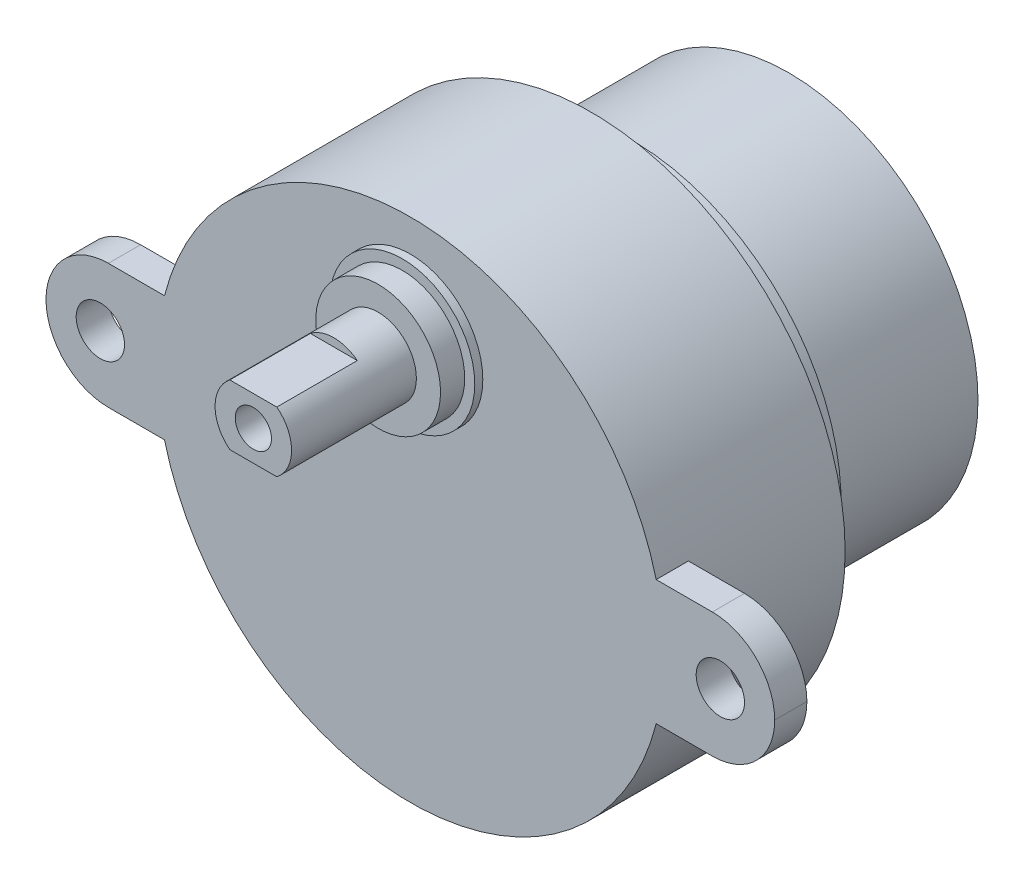
from build123d import *

# Parameters (mm, degrees)
SKETCH1_R               = 16.002
BOSS_EXTRUDE1_DEPTH     = 13.97
SKETCH2_R               = 11.938
BOSS_EXTRUDE2_DEPTH     = 9.906
CUT_EXTRUDE1_START      = -2.54
SKETCH3_R               = 16.002
SKETCH3_R_2             = 13.208
CUT_EXTRUDE1_DEPTH      = 2.54
SKETCH4_W               = 45.974
SKETCH4_H               = 7.874
BOSS_EXTRUDE3_DEPTH     = 2.032
CUT_EXTRUDE2_DEPTH      = 37.803933879
CUT_EXTRUDE2_DEPTH_BACK = 37.803933879
SKETCH5_R               = 1.524
FILLET1_R               = 3.937
SKETCH6_R               = 4.572
BOSS_EXTRUDE4_DEPTH     = 0.508
SKETCH7_R               = 3.937
BOSS_EXTRUDE5_DEPTH     = 2.032
SKETCH8_R               = 2.413
BOSS_EXTRUDE6_DEPTH     = 9.906
CUT_EXTRUDE3_DEPTH      = 44.88268106
CUT_EXTRUDE3_DEPTH_BACK = 5.08
SKETCH10_R              = 1.143
CUT_EXTRUDE4_DEPTH      = 7.874


with BuildPart() as part:
    # Sketch1 → Boss-Extrude1 (new body)
    with BuildSketch(Plane.XY):
        Circle(SKETCH1_R)
    extrude(amount=-BOSS_EXTRUDE1_DEPTH)

    # Sketch2 → Boss-Extrude2 (add)
    with BuildSketch(Plane(origin=(0, 0, -13.97), x_dir=(-1, 0, 0), z_dir=(0, 0, -1))):
        Circle(SKETCH2_R)
    extrude(amount=BOSS_EXTRUDE2_DEPTH)

    # Sketch3 → Cut-Extrude1 (cut)
    with BuildSketch(Plane(origin=(0, 0, -13.97), x_dir=(-1, 0, 0), z_dir=(0, 0, -1)).offset(CUT_EXTRUDE1_START)):
        with Locations(Location((0, 0, 0), (0, 0, 180))):
            Circle(SKETCH3_R)
        Circle(SKETCH3_R_2, mode=Mode.SUBTRACT)
    extrude(amount=CUT_EXTRUDE1_DEPTH, mode=Mode.SUBTRACT)

    # Sketch4 → Boss-Extrude3 (add)
    with BuildSketch(Plane.XY):
        Rectangle(SKETCH4_W, SKETCH4_H)
    extrude(amount=-BOSS_EXTRUDE3_DEPTH)

    # Sketch5 → Cut-Extrude2 (cut, two sides: drawn at the far end of the back side and taken through both)
    with BuildSketch(Plane.XY.offset(-CUT_EXTRUDE2_DEPTH_BACK)):
        with Locations((-19.558, 0)):
            Circle(SKETCH5_R)
        with Locations((19.558, 0)):
            Circle(SKETCH5_R)
    extrude(amount=CUT_EXTRUDE2_DEPTH + CUT_EXTRUDE2_DEPTH_BACK, mode=Mode.SUBTRACT)

    # Fillet1
    fillet1_edges = [part.edges().sort_by_distance(p)[0] for p in [
        (22.987, 3.937, -1.016),
        (22.987, -3.937, -1.016),
        (-22.987, -3.937, -1.016),
        (-22.987, 3.937, -1.016),
    ]]
    fillet(fillet1_edges, radius=FILLET1_R - 0.0001)  # a hair under: the kernel refuses the full size

    # Sketch6 → Boss-Extrude4 (add)
    with BuildSketch(Plane.XY):
        with Locations((0, 9.398)):
            Circle(SKETCH6_R)
    extrude(amount=BOSS_EXTRUDE4_DEPTH)

    # Sketch7 → Boss-Extrude5 (add)
    with BuildSketch(Plane.XY):
        with Locations((0, 9.398)):
            Circle(SKETCH7_R)
    extrude(amount=BOSS_EXTRUDE5_DEPTH)

    # Sketch8 → Boss-Extrude6 (add)
    with BuildSketch(Plane.XY):
        with Locations((0, 9.398)):
            Circle(SKETCH8_R)
    extrude(amount=BOSS_EXTRUDE6_DEPTH)

    # Sketch9 → Cut-Extrude3 (cut, two sides: drawn at the far end of the back side and taken through both)
    with BuildSketch(Plane.XY.offset(9.906).offset(-CUT_EXTRUDE3_DEPTH_BACK)):
        with BuildLine():
            Line((-1.481061781, 11.303), (1.481061781, 11.303))
            ThreePointArc((1.481061781, 11.303), (0, 11.811), (-1.481061781, 11.303))
        make_face()
        with BuildLine():
            Line((-1.481061781, 7.493), (1.481061781, 7.493))
            ThreePointArc((1.481061781, 7.493), (0, 6.985), (-1.481061781, 7.493))
        make_face()
    extrude(amount=CUT_EXTRUDE3_DEPTH + CUT_EXTRUDE3_DEPTH_BACK, mode=Mode.SUBTRACT)

    # Sketch10 → Cut-Extrude4 (cut)
    with BuildSketch(Plane.XY.offset(9.906)):
        with Locations((0, 9.398)):
            Circle(SKETCH10_R)
    extrude(amount=-CUT_EXTRUDE4_DEPTH, mode=Mode.SUBTRACT)


solid = part.part
